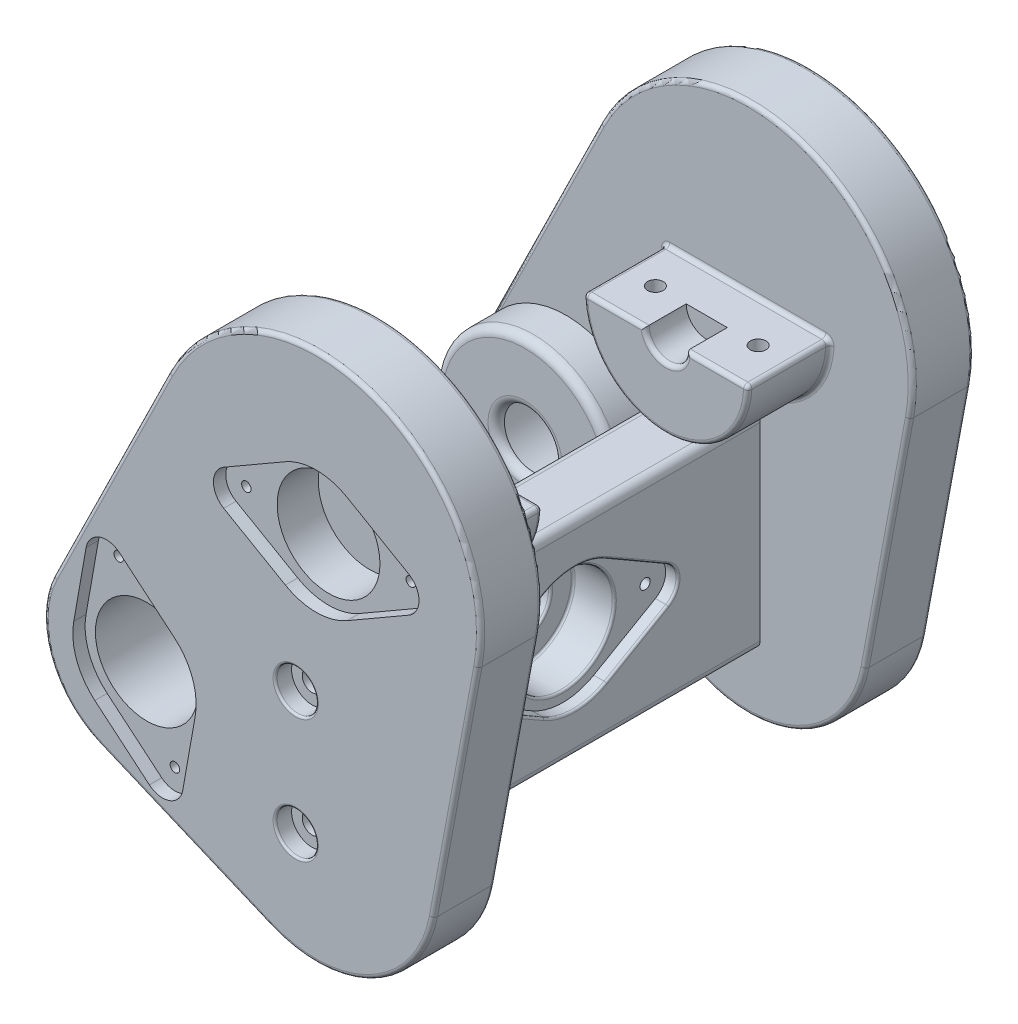
from build123d import *
from build123d.topology import SkipClean

# Parameters (mm, degrees)
SKETCH2_R            = 12.5
BOSS_EXTRUDE1_DEPTH  = 15
SKETCH13_W           = 16
SKETCH13_H           = 50
BOSS_EXTRUDE5_DEPTH  = 45
SKETCH14_R           = 12.5
CUT_EXTRUDE1_DEPTH   = 13
SKETCH15_R           = 1.25
CUT_EXTRUDE2_DEPTH   = 3
SKETCH16_R           = 7
SKETCH16_R_2         = 1.25
CUT_EXTRUDE3_DEPTH   = 116.628716156
FILLET3_R            = 0.5
FILLET4_R            = 0.5
FILLET5_R            = 0.5
BOSS_EXTRUDE7_DEPTH  = 15
BOSS_EXTRUDE8_START  = 10
SKETCH23_R           = 22
SKETCH23_R_2         = 12.5
BOSS_EXTRUDE8_DEPTH  = 10
SKETCH24_R           = 12.5
CUT_EXTRUDE4_DEPTH   = 147.049569685
SKETCH25_R           = 12.5
SKETCH25_R_2         = 7
BOSS_EXTRUDE9_DEPTH  = 2
CUT_EXTRUDE5_DEPTH   = 3
SKETCH27_R           = 1.15
CUT_EXTRUDE6_DEPTH   = 8
SKETCH28_R           = 20
BOSS_EXTRUDE10_DEPTH = 2
BOSS_EXTRUDE11_DEPTH = 20
SKETCH30_R           = 5
CUT_EXTRUDE7_DEPTH   = 10
SKETCH31_R           = 1.9
CUT_EXTRUDE8_DEPTH   = 12
CUT_EXTRUDE9_DEPTH   = 3
SKETCH33_R           = 1.15
CUT_EXTRUDE10_DEPTH  = 8
FILLET6_R            = 1
FILLET7_R            = 1
FILLET8_R            = 2
FILLET9_R            = 2
SKETCH35_R           = 2.4
CUT_EXTRUDE12_DEPTH  = 164.418104317
SKETCH37_R           = 5
CUT_EXTRUDE14_DEPTH  = 4
FILLET11_R           = 0.5


# Some blends are built 0.0001 mm under size
with BuildPart() as part:
    # Sketch2 → Boss-Extrude1 (new body)
    with BuildSketch(Plane.XY.offset(60)):
        with BuildLine():
            Line((-39.322032275, -7.333333333), (-28.508473399, -65.316666667))
            ThreePointArc((-28.508473399, -65.316666667), (0, -89), (28.508473399, -65.316666667))
            Line((28.508473399, -65.316666667), (39.322032275, -7.333333333))
            ThreePointArc((39.322032275, -7.333333333), (0, 40), (-39.322032275, -7.333333333))
        make_face()
        Circle(SKETCH2_R, mode=Mode.SUBTRACT)
    boss_extrude1 = extrude(amount=-BOSS_EXTRUDE1_DEPTH)

    # Sketch13 → Boss-Extrude5 (add)
    with BuildSketch(Plane(origin=(0, 0, 45), x_dir=(-1, 0, 0), z_dir=(0, 0, -1))):
        with Locations((5, -49)):
            Rectangle(SKETCH13_W, SKETCH13_H)
    boss_extrude5 = extrude(amount=BOSS_EXTRUDE5_DEPTH)

    # Mirror2: Boss-Extrude5 across plane
    add(boss_extrude5.mirror(Plane.XY))

    # Mirror4: Boss-Extrude1 across plane
    add(boss_extrude1.mirror(Plane.XY))

    # Sketch14 → Cut-Extrude1 (cut)
    with BuildSketch(Plane(origin=(3, 0, 0), x_dir=(0, 0, -1), z_dir=(1, 0, 0))):
        with Locations((0, -49)):
            Circle(SKETCH14_R)
    extrude(amount=-CUT_EXTRUDE1_DEPTH, mode=Mode.SUBTRACT)

    # Sketch15 → Cut-Extrude2 (cut)
    with BuildSketch(Plane(origin=(3, 0, 0), x_dir=(0, 0, -1), z_dir=(1, 0, 0))):
        with BuildLine():
            Line((-22.5, -44.669872981), (-7.5, -36.009618943))
            ThreePointArc((-7.5, -36.009618943), (0, -34), (7.5, -36.009618943))
            Line((7.5, -36.009618943), (22.5, -44.669872981))
            ThreePointArc((22.5, -44.669872981), (25, -49), (22.5, -53.330127019))
            Line((22.5, -53.330127019), (7.5, -61.990381057))
            ThreePointArc((7.5, -61.990381057), (0, -64), (-7.5, -61.990381057))
            Line((-7.5, -61.990381057), (-22.5, -53.330127019))
            ThreePointArc((-22.5, -53.330127019), (-25, -49), (-22.5, -44.669872981))
        make_face()
        with Locations((20, -49)):
            Circle(SKETCH15_R, mode=Mode.SUBTRACT)
        with Locations((-20, -49)):
            Circle(SKETCH15_R, mode=Mode.SUBTRACT)
    extrude(amount=-CUT_EXTRUDE2_DEPTH, mode=Mode.SUBTRACT)

    # Sketch16 → Cut-Extrude3 (cut, through all)
    with BuildSketch(Plane(origin=(3, 0, 0), x_dir=(0, 0, -1), z_dir=(1, 0, 0))):
        with Locations((0, -49)):
            Circle(SKETCH16_R)
        with Locations((20, -49)):
            Circle(SKETCH16_R_2)
        with Locations((-20, -49)):
            Circle(SKETCH16_R_2)
    extrude(amount=-CUT_EXTRUDE3_DEPTH, mode=Mode.SUBTRACT)

    # Fillet3
    fillet3_edges = [part.edges().sort_by_distance(p)[0] for p in [
        (-10, -49, 7),
        (-10, -49, 12.5),
        (0, -49, 12.5),
    ]]
    fillet(fillet3_edges, radius=FILLET3_R)

    # Fillet4
    fillet4_edges = [part.edges().sort_by_distance(p)[0] for p in [
        (-13, -49, 7),
    ]]
    fillet(fillet4_edges, radius=FILLET4_R)

    # Fillet5
    fillet5_edges = [part.edges().sort_by_distance(p)[0] for p in [
        (3, -49, 25),
        (3, -57.660254038, 15),
        (3, -64, 0),
        (3, -57.660254038, -15),
        (3, -49, -25),
        (3, -40.339745962, -15),
        (3, -34, 0),
        (3, -40.339745962, 15),
    ]]
    fillet(fillet5_edges, radius=FILLET5_R)

    # Sketch21 → Boss-Extrude7 (add)
    with BuildSketch(Plane(origin=(0, 0, 45), x_dir=(-1, 0, 0), z_dir=(0, 0, -1))):
        with BuildLine():
            Line((63.949121417, -39.274799426), (35.879526324, 17.682182861))
            ThreePointArc((35.879526324, 17.682182861), (39.626539296, 5.453199377), (39.322032275, -7.333333333))
            Line((39.322032275, -7.333333333), (32.183280175, -45.612002486))
            ThreePointArc((32.183280175, -45.612002486), (45.925459124, -36.617527064), (56.715381939, -49))
            ThreePointArc((56.715381939, -49), (43.626354657, -61.486114162), (31.770894441, -47.823254098))
            Line((31.770894441, -47.823254098), (28.508473399, -65.316666667))
            ThreePointArc((28.508473399, -65.316666667), (22.576057553, -78.202242316), (11.241719496, -86.732447377))
            Line((11.241719496, -86.732447377), (52.743582936, -69.279787666))
            ThreePointArc((52.743582936, -69.279787666), (64.82506776, -56.696807802), (63.949121417, -39.274799426))
        make_face()
        with BuildLine():
            ThreePointArc((39.322032275, -7.333333333), (39.626539296, 5.453199377), (35.879526324, 17.682182861))
            Line((35.879526324, 17.682182861), (11.241719496, -86.732447377))
            ThreePointArc((11.241719496, -86.732447377), (22.576057553, -78.202242316), (28.508473399, -65.316666667))
            Line((28.508473399, -65.316666667), (31.770894441, -47.823254098))
            ThreePointArc((31.770894441, -47.823254098), (31.927246853, -46.708333333), (32.183280175, -45.612002486))
            Line((32.183280175, -45.612002486), (39.322032275, -7.333333333))
        make_face()
    boss_extrude7 = extrude(amount=-BOSS_EXTRUDE7_DEPTH)

    # Sketch23 → Boss-Extrude8 (add)
    with SkipClean():  # the faces are left unmerged after this step: merging them gives an invalid solid
        with BuildSketch(Plane(origin=(0, 0, 45), x_dir=(-1, 0, 0), z_dir=(0, 0, -1)).offset(BOSS_EXTRUDE8_START)):
            with Locations((44.215381939, -49)):
                Circle(SKETCH23_R)
            with Locations((44.215381939, -49)):
                Circle(SKETCH23_R_2, mode=Mode.SUBTRACT)
        boss_extrude8 = extrude(amount=-BOSS_EXTRUDE8_DEPTH)

    # Sketch24 → Cut-Extrude4 (cut, through all)
    with SkipClean():  # the faces are left unmerged after this step: merging them gives an invalid solid
        with BuildSketch(Plane(origin=(0, 0, 35), x_dir=(-1, 0, 0), z_dir=(0, 0, -1))):
            with Locations((44.215381939, -49)):
                Circle(SKETCH24_R)
        cut_extrude4 = extrude(amount=-CUT_EXTRUDE4_DEPTH, mode=Mode.SUBTRACT)
    add(part.part.scale(1), mode=Mode.REPLACE)  # the faces are merged on a copy

    # Sketch25 → Boss-Extrude9 (add)
    with BuildSketch(Plane(origin=(0, 0, 35), x_dir=(-1, 0, 0), z_dir=(0, 0, -1))):
        with Locations((44.215381939, -49)):
            Circle(SKETCH25_R)
        with Locations((44.215381939, -49)):
            Circle(SKETCH25_R_2, mode=Mode.SUBTRACT)
    boss_extrude9 = extrude(amount=-BOSS_EXTRUDE9_DEPTH)

    # Sketch26 → Cut-Extrude5 (cut)
    with BuildSketch(Plane.XY.offset(60)):
        with BuildLine():
            Line((-34.573567794, -37.509333353), (-47.841846757, -26.375925369))
            ThreePointArc((-47.841846757, -26.375925369), (-52.765885522, -25.50768448), (-55.97982357, -29.337906696))
            Line((-55.97982357, -29.337906696), (-58.987498234, -46.395277335))
            ThreePointArc((-58.987498234, -46.395277335), (-58.310771251, -54.13030215), (-53.857196084, -60.490666647))
            Line((-53.857196084, -60.490666647), (-40.588917121, -71.624074631))
            ThreePointArc((-40.588917121, -71.624074631), (-35.664878356, -72.49231552), (-32.450940307, -68.662093304))
            Line((-32.450940307, -68.662093304), (-29.443265644, -51.604722665))
            ThreePointArc((-29.443265644, -51.604722665), (-30.119992627, -43.86969785), (-34.573567794, -37.509333353))
        make_face()
    cut_extrude5 = extrude(amount=-CUT_EXTRUDE5_DEPTH, mode=Mode.SUBTRACT)

    # Sketch27 → Cut-Extrude6 (cut)
    with BuildSketch(Plane.XY.offset(57)):
        with Locations((-51.055784805, -30.206147584)):
            Circle(SKETCH27_R)
        with Locations((-37.374979072, -67.793852416)):
            Circle(SKETCH27_R)
    cut_extrude6 = extrude(amount=-CUT_EXTRUDE6_DEPTH, mode=Mode.SUBTRACT)

    # Mirror12: Boss-Extrude7, Boss-Extrude8, Cut-Extrude4, Boss-Extrude9, Cut-Extrude5, Cut-Extrude6 across plane
    with SkipClean():  # the faces are left unmerged after this step: merging them gives an invalid solid
        add(boss_extrude7.mirror(Plane.XY))
        add(boss_extrude8.mirror(Plane.XY))
        add(cut_extrude4.mirror(Plane.XY), mode=Mode.SUBTRACT)
        add(boss_extrude9.mirror(Plane.XY))
        add(cut_extrude5.mirror(Plane.XY), mode=Mode.SUBTRACT)
        add(cut_extrude6.mirror(Plane.XY), mode=Mode.SUBTRACT)

    # Sketch28 → Boss-Extrude10 (add)
    with SkipClean():  # the faces are left unmerged after this step: merging them gives an invalid solid
        with BuildSketch(Plane(origin=(0, 0, 45), x_dir=(-1, 0, 0), z_dir=(0, 0, -1))):
            Circle(SKETCH28_R)
        boss_extrude10 = extrude(amount=-BOSS_EXTRUDE10_DEPTH)

    # Sketch29 → Boss-Extrude11 (add)
    with SkipClean():  # the faces are left unmerged after this step: merging them gives an invalid solid
        with BuildSketch(Plane(origin=(0, 0, 45), x_dir=(-1, 0, 0), z_dir=(0, 0, -1))):
            with BuildLine():
                Line((-20, 0), (20, 0))
                ThreePointArc((20, 0), (0, -20), (-20, 0))
            make_face()
        boss_extrude11 = extrude(amount=BOSS_EXTRUDE11_DEPTH)

    # Sketch30 → Cut-Extrude7 (cut)
    with SkipClean():  # the faces are left unmerged after this step: merging them gives an invalid solid
        with BuildSketch(Plane(origin=(0, 0, 25), x_dir=(-1, 0, 0), z_dir=(0, 0, -1))):
            Circle(SKETCH30_R)
        cut_extrude7 = extrude(amount=-CUT_EXTRUDE7_DEPTH, mode=Mode.SUBTRACT)

    # Sketch31 → Cut-Extrude8 (cut)
    with SkipClean():  # the faces are left unmerged after this step: merging them gives an invalid solid
        with BuildSketch(Plane(origin=(0, 0, 0), x_dir=(1, 0, 0), z_dir=(0, 1, 0))):
            with Locations(Location((-12.5, -35, 0), (0, 0, 270))):
                Circle(SKETCH31_R)
            with Locations(Location((12.5, -35, 0), (0, 0, 270))):
                Circle(SKETCH31_R)
        cut_extrude8 = extrude(amount=-CUT_EXTRUDE8_DEPTH, mode=Mode.SUBTRACT)

    # Sketch32 → Cut-Extrude9 (cut)
    with SkipClean():  # the faces are left unmerged after this step: merging them gives an invalid solid
        with BuildSketch(Plane(origin=(-30.922387151, 58.307855156, 60), x_dir=(0.34202014332566366, 0.9396926207859102, 0), z_dir=(0, 0, 1))):
            with BuildLine():
                Line((-34.573567794, -37.509333353), (-47.841846757, -26.375925369))
                ThreePointArc((-47.841846757, -26.375925369), (-52.765885522, -25.50768448), (-55.97982357, -29.337906696))
                Line((-55.97982357, -29.337906696), (-58.987498234, -46.395277335))
                ThreePointArc((-58.987498234, -46.395277335), (-58.310771251, -54.13030215), (-53.857196084, -60.490666647))
                Line((-53.857196084, -60.490666647), (-40.588917121, -71.624074631))
                ThreePointArc((-40.588917121, -71.624074631), (-35.664878356, -72.49231552), (-32.450940307, -68.662093304))
                Line((-32.450940307, -68.662093304), (-29.443265644, -51.604722665))
                ThreePointArc((-29.443265644, -51.604722665), (-30.119992627, -43.86969785), (-34.573567794, -37.509333353))
            make_face()
        cut_extrude9 = extrude(amount=-CUT_EXTRUDE9_DEPTH, mode=Mode.SUBTRACT)

    # Sketch33 → Cut-Extrude10 (cut)
    with SkipClean():  # the faces are left unmerged after this step: merging them gives an invalid solid
        with BuildSketch(Plane.XY.offset(57)):
            with Locations((20, 0)):
                Circle(SKETCH33_R)
            with Locations((-20, 0)):
                Circle(SKETCH33_R)
        cut_extrude10 = extrude(amount=-CUT_EXTRUDE10_DEPTH, mode=Mode.SUBTRACT)

    # Mirror13: Boss-Extrude10, Boss-Extrude11, Cut-Extrude7, Cut-Extrude8, Cut-Extrude9, Cut-Extrude10 across plane
    with SkipClean():  # the faces are left unmerged after this step: merging them gives an invalid solid
        add(boss_extrude10.mirror(Plane.XY))
        add(boss_extrude11.mirror(Plane.XY))
        add(cut_extrude7.mirror(Plane.XY), mode=Mode.SUBTRACT)
        add(cut_extrude8.mirror(Plane.XY), mode=Mode.SUBTRACT)
        add(cut_extrude9.mirror(Plane.XY), mode=Mode.SUBTRACT)
        add(cut_extrude10.mirror(Plane.XY), mode=Mode.SUBTRACT)

    # Fillet6
    # the kernel refuses this fillet: 1 mm, written as the material it takes off along each edge
    with BuildSketch(Plane(origin=(0, -60, 60), x_dir=(-0.38764549985050817, -0.9218085302521613, 0), z_dir=(-0.9218085302521613, 0.38764549985050817, 0))) as fillet6_piece_1:
        with BuildLine():
            CenterArc((29 - FILLET6_R, -FILLET6_R), FILLET6_R, 0, 90)
            Line((29 - FILLET6_R, 0), (29, 0))
            Line((29, 0), (29, -FILLET6_R))
        make_face()
    revolve(axis=Axis((0, -60, 60), (0, 0, 1)), revolution_arc=102.244097048, mode=Mode.SUBTRACT)
    with BuildSketch(Plane(origin=(0, -60, 45), x_dir=(-0.38764549985050817, -0.9218085302521613, 0), z_dir=(-0.9218085302521613, 0.38764549985050817, 0))) as fillet6_piece_2:
        with BuildLine():
            CenterArc((29 - FILLET6_R, FILLET6_R), FILLET6_R, 270, 90)
            Line((29, FILLET6_R), (29, 0))
            Line((29, 0), (29 - FILLET6_R, 0))
        make_face()
    revolve(axis=Axis((0, -60, 45), (0, 0, 1)), revolution_arc=102.244097048, mode=Mode.SUBTRACT)
    with BuildSketch(Plane(origin=(-63.949121417, -39.274799426, 60), x_dir=(0, 0, -1), z_dir=(0.4420545715370929, 0.8969881581064252, 0))) as fillet6_piece_3:
        with BuildLine():
            CenterArc((FILLET6_R, -FILLET6_R), FILLET6_R, 90, 90)
            Line((0, -FILLET6_R), (0, 0))
            Line((0, 0), (FILLET6_R, 0))
        make_face()
    extrude(amount=63.498031466, mode=Mode.SUBTRACT)
    with BuildSketch(Plane(origin=(-11.241719496, -86.732447377, 45), x_dir=(0.38764549985050845, 0.9218085302521613, 0), z_dir=(-0.9218085302521611, 0.38764549985050845, 0))) as fillet6_piece_4_section:
        with BuildLine():
            CenterArc((FILLET6_R, -FILLET6_R), FILLET6_R, 90, 90)
            Line((0, -FILLET6_R), (0, 0))
            Line((0, 0), (FILLET6_R, 0))
        make_face()
    fillet6_piece_4 = extrude(amount=52.522216738, mode=Mode.PRIVATE)
    fillet6_piece_4 = fillet6_piece_4 - Plane(origin=(-44.215381939, -49, 45), x_dir=(-1, 0, 0), z_dir=(0, 0, -1)) * Cylinder(22, 110, mode=Mode.PRIVATE)
    add(fillet6_piece_4, mode=Mode.SUBTRACT)
    with BuildSketch(Plane(origin=(-44.215381939, -49, 60), x_dir=(-0.3876454998505073, -0.9218085302521616, 0), z_dir=(0.9218085302521616, -0.3876454998505073, 0))) as fillet6_piece_5:
        with BuildLine():
            CenterArc((22 - FILLET6_R, FILLET6_R), FILLET6_R, 270, 90)
            Line((22 - FILLET6_R, 0), (22, 0))
            Line((22, 0), (22, FILLET6_R))
        make_face()
    revolve(axis=Axis((-44.215381939, -49, 60), (0, 0, -1)), revolution_arc=93.426969898, mode=Mode.SUBTRACT)
    with BuildSketch(Plane(origin=(-11.241719496, -86.732447377, 60), x_dir=(0, 0, -1), z_dir=(-0.9218085302521611, 0.38764549985050845, 0))) as fillet6_piece_6:
        with BuildLine():
            CenterArc((FILLET6_R, -FILLET6_R), FILLET6_R, 90, 90)
            Line((0, -FILLET6_R), (0, 0))
            Line((0, 0), (FILLET6_R, 0))
        make_face()
    extrude(amount=45.022216738, mode=Mode.SUBTRACT)
    with BuildSketch(Plane(origin=(-67.264530704, -46.002210612, 45), x_dir=(0.8969881581064253, -0.4420545715370929, 0), z_dir=(0.4420545715370929, 0.8969881581064252, 0))) as fillet6_piece_7_section:
        with BuildLine():
            CenterArc((FILLET6_R, -FILLET6_R), FILLET6_R, 90, 90)
            Line((0, -FILLET6_R), (0, 0))
            Line((0, 0), (FILLET6_R, 0))
        make_face()
    fillet6_piece_7 = extrude(amount=70.998031466, mode=Mode.PRIVATE)
    fillet6_piece_7 = fillet6_piece_7 - Plane(origin=(-44.215381939, -49, 45), x_dir=(-1, 0, 0), z_dir=(0, 0, -1)) * Cylinder(22, 146, mode=Mode.PRIVATE)
    add(fillet6_piece_7, mode=Mode.SUBTRACT)
    with BuildSketch(Plane(origin=(28.508473399, -65.316666667, 45), x_dir=(-0.9830508068705752, 0.18333333333333338, 0), z_dir=(0.1833333333333334, 0.9830508068705752, 0)), Plane(origin=(28.508473399, -65.316666667, 60), x_dir=(0, 0, -1), z_dir=(0.1833333333333334, 0.9830508068705752, 0))) as fillet6_piece_8:
        with BuildLine():
            CenterArc((FILLET6_R, FILLET6_R), FILLET6_R, 180, 90)
            Line((0, FILLET6_R), (0, 0))
            Line((0, 0), (FILLET6_R, 0))
        make_face()
    extrude(amount=58.983048412, mode=Mode.SUBTRACT)
    with BuildSketch(Plane(origin=(0, -60, -60), x_dir=(-0.38764549985050817, -0.9218085302521613, 0), z_dir=(-0.9218085302521613, 0.38764549985050817, 0))) as fillet6_piece_9:
        with BuildLine():
            CenterArc((29 - FILLET6_R, FILLET6_R), FILLET6_R, 270, 90)
            Line((29 - FILLET6_R, 0), (29, 0))
            Line((29, 0), (29, FILLET6_R))
        make_face()
    revolve(axis=Axis((0, -60, -60), (0, 0, 1)), revolution_arc=102.244097048, mode=Mode.SUBTRACT)
    with BuildSketch(Plane(origin=(0, -60, -45), x_dir=(-0.38764549985050817, -0.9218085302521613, 0), z_dir=(-0.9218085302521613, 0.38764549985050817, 0))) as fillet6_piece_10:
        with BuildLine():
            CenterArc((29 - FILLET6_R, -FILLET6_R), FILLET6_R, 0, 90)
            Line((29, -FILLET6_R), (29, 0))
            Line((29, 0), (29 - FILLET6_R, 0))
        make_face()
    revolve(axis=Axis((0, -60, -45), (0, 0, 1)), revolution_arc=102.244097048, mode=Mode.SUBTRACT)
    with BuildSketch(Plane(origin=(-11.241719496, -86.732447377, -60), x_dir=(0, 0, 1), z_dir=(-0.9218085302521611, 0.38764549985050845, 0))) as fillet6_piece_11:
        with BuildLine():
            CenterArc((FILLET6_R, FILLET6_R), FILLET6_R, 180, 90)
            Line((0, FILLET6_R), (0, 0))
            Line((0, 0), (FILLET6_R, 0))
        make_face()
    extrude(amount=45.022216738, mode=Mode.SUBTRACT)
    with BuildSketch(Plane(origin=(-44.215381939, -49, -60), x_dir=(-0.3876454998505073, -0.9218085302521616, 0), z_dir=(0.9218085302521616, -0.3876454998505073, 0))) as fillet6_piece_12:
        with BuildLine():
            CenterArc((22 - FILLET6_R, -FILLET6_R), FILLET6_R, 0, 90)
            Line((22 - FILLET6_R, 0), (22, 0))
            Line((22, 0), (22, -FILLET6_R))
        make_face()
    revolve(axis=Axis((-44.215381939, -49, -60), (0, 0, -1)), revolution_arc=93.426969898, mode=Mode.SUBTRACT)
    with BuildSketch(Plane(origin=(-67.264530704, -46.002210612, -45), x_dir=(0.8969881581064253, -0.4420545715370929, 0), z_dir=(0.4420545715370929, 0.8969881581064252, 0))) as fillet6_piece_13_section:
        with BuildLine():
            CenterArc((FILLET6_R, FILLET6_R), FILLET6_R, 180, 90)
            Line((0, FILLET6_R), (0, 0))
            Line((0, 0), (FILLET6_R, 0))
        make_face()
    fillet6_piece_13 = extrude(amount=70.998031466, mode=Mode.PRIVATE)
    fillet6_piece_13 = fillet6_piece_13 - Plane(origin=(-44.215381939, -49, -45), x_dir=(-1, 0, 0), z_dir=(0, 0, 1)) * Cylinder(22, 146, mode=Mode.PRIVATE)
    add(fillet6_piece_13, mode=Mode.SUBTRACT)
    with BuildSketch(Plane(origin=(-63.949121417, -39.274799426, -60), x_dir=(0, 0, 1), z_dir=(0.4420545715370929, 0.8969881581064252, 0))) as fillet6_piece_14:
        with BuildLine():
            CenterArc((FILLET6_R, FILLET6_R), FILLET6_R, 180, 90)
            Line((0, FILLET6_R), (0, 0))
            Line((0, 0), (FILLET6_R, 0))
        make_face()
    extrude(amount=63.498031466, mode=Mode.SUBTRACT)
    with BuildSketch(Plane(origin=(-11.241719496, -86.732447377, -45), x_dir=(0.38764549985050845, 0.9218085302521613, 0), z_dir=(-0.9218085302521611, 0.38764549985050845, 0))) as fillet6_piece_15_section:
        with BuildLine():
            CenterArc((FILLET6_R, FILLET6_R), FILLET6_R, 180, 90)
            Line((0, FILLET6_R), (0, 0))
            Line((0, 0), (FILLET6_R, 0))
        make_face()
    fillet6_piece_15 = extrude(amount=52.522216738, mode=Mode.PRIVATE)
    fillet6_piece_15 = fillet6_piece_15 - Plane(origin=(-44.215381939, -49, -45), x_dir=(-1, 0, 0), z_dir=(0, 0, 1)) * Cylinder(22, 110, mode=Mode.PRIVATE)
    add(fillet6_piece_15, mode=Mode.SUBTRACT)
    with BuildSketch(Plane(origin=(0, 0, -45), x_dir=(0.9830508068705752, -0.18333333333333324, 0), z_dir=(-0.18333333333333324, -0.9830508068705752, 0))) as fillet6_piece_16:
        with BuildLine():
            CenterArc((40 - FILLET6_R, -FILLET6_R), FILLET6_R, 0, 90)
            Line((40, -FILLET6_R), (40, 0))
            Line((40, 0), (40 - FILLET6_R, 0))
        make_face()
    revolve(axis=Axis((0, 0, -45), (0, 0, 1)), revolution_arc=164.328933054, mode=Mode.SUBTRACT)
    with BuildSketch(Plane(origin=(28.508473399, -65.316666667, -45), x_dir=(-0.9830508068705752, 0.18333333333333338, 0), z_dir=(0.1833333333333334, 0.9830508068705752, 0)), Plane(origin=(28.508473399, -65.316666667, -60), x_dir=(0, 0, 1), z_dir=(0.1833333333333334, 0.9830508068705752, 0))) as fillet6_piece_17:
        with BuildLine():
            CenterArc((FILLET6_R, -FILLET6_R), FILLET6_R, 90, 90)
            Line((0, -FILLET6_R), (0, 0))
            Line((0, 0), (FILLET6_R, 0))
        make_face()
    extrude(amount=58.983048412, mode=Mode.SUBTRACT)
    with BuildSketch(Plane(origin=(0, 0, -60), x_dir=(0.9830508068705752, -0.18333333333333324, 0), z_dir=(-0.18333333333333324, -0.9830508068705752, 0))) as fillet6_piece_18:
        with BuildLine():
            CenterArc((40 - FILLET6_R, FILLET6_R), FILLET6_R, 270, 90)
            Line((40 - FILLET6_R, 0), (40, 0))
            Line((40, 0), (40, FILLET6_R))
        make_face()
    revolve(axis=Axis((0, 0, -60), (0, 0, 1)), revolution_arc=164.328933054, mode=Mode.SUBTRACT)
    with BuildSketch(Plane(origin=(0, 0, 45), x_dir=(0.9830508068705752, -0.18333333333333324, 0), z_dir=(-0.18333333333333324, -0.9830508068705752, 0))) as fillet6_piece_19:
        with BuildLine():
            CenterArc((40 - FILLET6_R, FILLET6_R), FILLET6_R, 270, 90)
            Line((40, FILLET6_R), (40, 0))
            Line((40, 0), (40 - FILLET6_R, 0))
        make_face()
    revolve(axis=Axis((0, 0, 45), (0, 0, 1)), revolution_arc=164.328933054, mode=Mode.SUBTRACT)
    with BuildSketch(Plane(origin=(0, 0, 60), x_dir=(0.9830508068705752, -0.18333333333333324, 0), z_dir=(-0.18333333333333324, -0.9830508068705752, 0))) as fillet6_piece_20:
        with BuildLine():
            CenterArc((40 - FILLET6_R, -FILLET6_R), FILLET6_R, 0, 90)
            Line((40 - FILLET6_R, 0), (40, 0))
            Line((40, 0), (40, -FILLET6_R))
        make_face()
    revolve(axis=Axis((0, 0, 60), (0, 0, 1)), revolution_arc=164.328933054, mode=Mode.SUBTRACT)

    # Fillet7
    fillet7_edges = [part.edges().sort_by_distance(p)[0] for p in [
        (0, -20, 45),
        (20, 0, 35),
        (0, 0, 45),
        (-20, 0, 35),
        (0, -20, 25),
        (-12.5, 0, 25),
        (12.5, 0, 25),
        (0, -5, 25),
        (0, -20, -25),
        (-20, 0, -35),
        (-12.5, 0, -25),
        (20, 0, -35),
        (0, -20, -45),
        (0, 0, -45),
        (12.5, 0, -25),
        (0, -5, -25),
    ]]
    fillet(fillet7_edges, radius=FILLET7_R)

    # Fillet8
    fillet8_edges = [part.edges().sort_by_distance(p)[0] for p in [
        (-13, -24, 0),
        (-13, -74, 0),
        (3, -74, 0),
        (3, -24, 0),
    ]]
    fillet(fillet8_edges, radius=FILLET8_R)

    # Fillet9
    fillet9_edges = [part.edges().sort_by_distance(p)[0] for p in [
        (-22.215381939, -49, 35),
        (-37.215381939, -49, 35),
        (-22.215381939, -49, -35),
        (-37.215381939, -49, -35),
    ]]
    fillet(fillet9_edges, radius=FILLET9_R - 0.0001)  # a hair under: the kernel refuses the full size

    # Sketch35 → Cut-Extrude12 (cut, through all)
    with BuildSketch(Plane.XY.offset(60)):
        with Locations((-5, -34)):
            Circle(SKETCH35_R)
        with Locations((-5, -64)):
            Circle(SKETCH35_R)
    extrude(amount=-CUT_EXTRUDE12_DEPTH, mode=Mode.SUBTRACT)

    # Sketch37 → Cut-Extrude14 (cut)
    with BuildSketch(Plane.XY.offset(60)):
        with Locations((-5, -34)):
            Circle(SKETCH37_R)
        with Locations((-5, -64)):
            Circle(SKETCH37_R)
    extrude(amount=-CUT_EXTRUDE14_DEPTH, mode=Mode.SUBTRACT)

    # Fillet11
    fillet11_edges = [part.edges().sort_by_distance(p)[0] for p in [
        (-10, -34, 60),
        (-10, -64, 60),
    ]]
    fillet(fillet11_edges, radius=FILLET11_R)


solid = part.part
